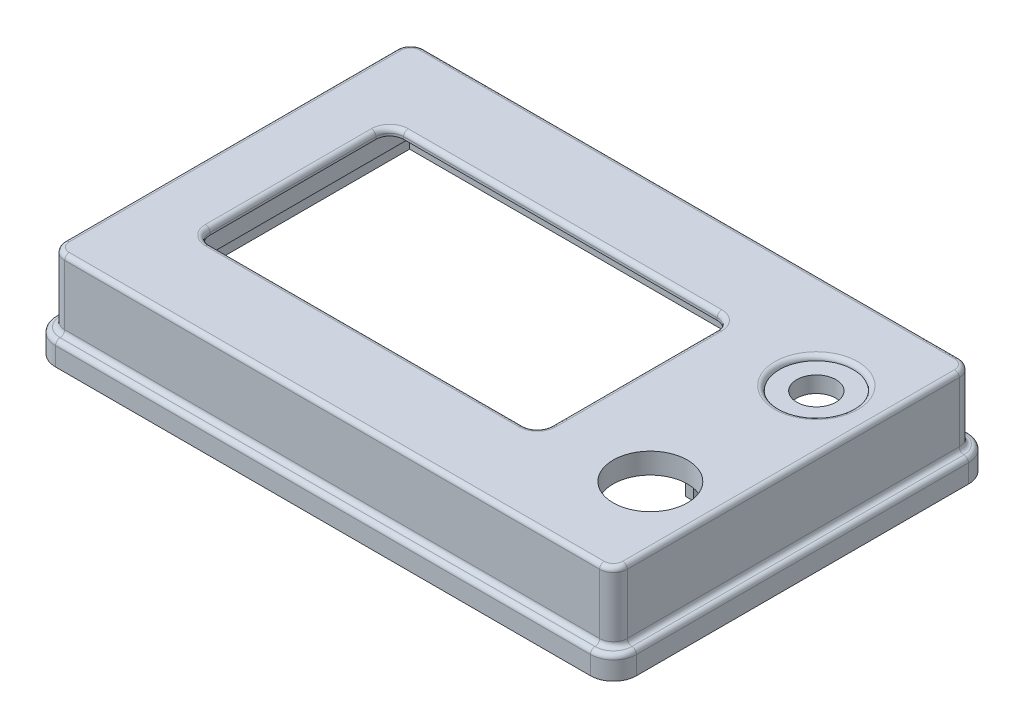
from build123d import *

# Parameters (mm, degrees)
SKETCH1_W                = 122
SKETCH1_H                = 78
SKETCH1_W_2              = 117
SKETCH1_H_2              = 73
BOSS_EXTRUDE1_DEPTH      = 16
SKETCH2_W                = 122
SKETCH2_H                = 78
SKETCH2_W_2              = 74
SKETCH2_H_2              = 42
BOSS_EXTRUDE2_DEPTH      = 2.5
SKETCH3_W                = 80
SKETCH3_H                = 48
CUT_EXTRUDE1_DEPTH       = 1
FILLET1_R                = 3
SKETCH4_R                = 4.25
SKETCH4_R_2              = 8.05
CUT_EXTRUDE2_DEPTH       = 84.00150601
SKETCH5_W                = 20.5
SKETCH5_H                = 73
SKETCH5_R                = 4.25
SKETCH5_R_2              = 8.05
BOSS_EXTRUDE3_DEPTH      = 2
SKETCH6_R                = 8
CUT_EXTRUDE3_DEPTH       = 1
FILLET2_R                = 3
SKETCH7_W                = 1.713480086
SKETCH7_H                = 2
BOSS_EXTRUDE4_DEPTH      = 3
BOSS_EXTRUDE5_DEPTH      = 1.713480086
FILLET3_R                = 1
FILLET4_R                = 1
FILLET5_R                = 1
BOSS_EXTRUDE6_DEPTH      = 4
BOSS_EXTRUDE6_DEPTH_BACK = 1
SKETCH10_W               = 121
SKETCH10_H               = 76.6
CUT_EXTRUDE4_DEPTH       = 86.669422783
FILLET10_R               = 1


with BuildPart() as part:
    # Sketch1 → Boss-Extrude1 (new body)
    with BuildSketch(Plane(origin=(0, -3, 0), x_dir=(1, 0, 0), z_dir=(0, 1, 0))):
        with Locations((10.5, 0)):
            Rectangle(SKETCH1_W, SKETCH1_H)
        with Locations((10.5, 0)):
            Rectangle(SKETCH1_W_2, SKETCH1_H_2, mode=Mode.SUBTRACT)
    extrude(amount=BOSS_EXTRUDE1_DEPTH)

    # Sketch2 → Boss-Extrude2 (add)
    with BuildSketch(Plane(origin=(0, 13, 0), x_dir=(1, 0, 0), z_dir=(0, 1, 0))):
        with Locations((10.5, 0)):
            Rectangle(SKETCH2_W, SKETCH2_H)
        Rectangle(SKETCH2_W_2, SKETCH2_H_2, mode=Mode.SUBTRACT)
    extrude(amount=-BOSS_EXTRUDE2_DEPTH)

    # Sketch3 → Cut-Extrude1 (cut)
    with BuildSketch(Plane.XZ.offset(-10.5)):
        Rectangle(SKETCH3_W, SKETCH3_H)
    extrude(amount=-CUT_EXTRUDE1_DEPTH, mode=Mode.SUBTRACT)

    # Fillet1
    fillet1_edges = [part.edges().sort_by_distance(p)[0] for p in [
        (-50.5, 5, -39),
        (71.5, 5, -39),
        (71.5, 5, 39),
        (-50.5, 5, 39),
    ]]
    fillet(fillet1_edges, radius=FILLET1_R)

    # Sketch4 → Cut-Extrude2 (cut, through all)
    with BuildSketch(Plane(origin=(0, 13, 0), x_dir=(1, 0, 0), z_dir=(0, 1, 0))):
        with Locations(Location((58.5, 18, 0), (0, 0, 270))):
            Circle(SKETCH4_R)
        with Locations(Location((58.5, -18, 0), (0, 0, 270))):
            Circle(SKETCH4_R_2)
    extrude(amount=-CUT_EXTRUDE2_DEPTH, mode=Mode.SUBTRACT)

    # Sketch5 → Boss-Extrude3 (add)
    with BuildSketch(Plane.XZ.offset(-10.5)):
        with Locations((58.75, 0)):
            Rectangle(SKETCH5_W, SKETCH5_H)
        with Locations(Location((58.5, -18, 0), (0, 0, 90))):
            Circle(SKETCH5_R, mode=Mode.SUBTRACT)
        with Locations(Location((58.5, 18, 0), (0, 0, 90))):
            Circle(SKETCH5_R_2, mode=Mode.SUBTRACT)
    extrude(amount=BOSS_EXTRUDE3_DEPTH)

    # Sketch6 → Cut-Extrude3 (cut)
    with BuildSketch(Plane(origin=(0, 13, 0), x_dir=(1, 0, 0), z_dir=(0, 1, 0))):
        with Locations(Location((58.5, 18, 0), (0, 0, 270))):
            Circle(SKETCH6_R)
    extrude(amount=-CUT_EXTRUDE3_DEPTH, mode=Mode.SUBTRACT)

    # Fillet2
    fillet2_edges = [part.edges().sort_by_distance(p)[0] for p in [
        (37, 12.25, 21),
        (-37, 12.25, 21),
        (37, 12.25, -21),
        (-37, 12.25, -21),
    ]]
    fillet(fillet2_edges, radius=FILLET2_R)

    # Sketch7 → Boss-Extrude4 (add)
    with BuildSketch(Plane.XZ.offset(-8.5)):
        with Locations((58.5, 8.5)):
            Rectangle(SKETCH7_W, SKETCH7_H)
    extrude(amount=BOSS_EXTRUDE4_DEPTH)

    # Sketch8 → Boss-Extrude5 (add)
    with BuildSketch(Plane.ZY.offset(-57.643259957)):
        Polygon((7.5, 5.5), (0.486710099, 8.5), (7.5, 8.5), align=None)
    extrude(amount=-BOSS_EXTRUDE5_DEPTH)

    # Fillet3
    fillet3_edges = [part.edges().sort_by_distance(p)[0] for p in [
        (-50.5, 13, 0),
        (10.5, 13, -39),
        (10.5, 13, 39),
        (71.5, 13, 0),
        (70.621320344, 13, 38.121320344),
        (70.621320344, 13, -38.121320344),
        (-49.621320344, 13, 38.121320344),
        (-49.621320344, 13, -38.121320344),
    ]]
    fillet(fillet3_edges, radius=FILLET3_R)

    # Fillet4
    fillet4_edges = [part.edges().sort_by_distance(p)[0] for p in [
        (37, 13, 0),
        (0, 13, 21),
        (-37, 13, 0),
        (0, 13, -21),
        (36.121320344, 13, 20.121320344),
        (-36.121320344, 13, 20.121320344),
        (-36.121320344, 13, -20.121320344),
        (36.121320344, 13, -20.121320344),
    ]]
    fillet(fillet4_edges, radius=FILLET4_R)

    # Fillet5
    fillet5_edges = [part.edges().sort_by_distance(p)[0] for p in [
        (58.5, 13, -26),
    ]]
    fillet(fillet5_edges, radius=FILLET5_R - 0.0001)  # a hair under: the kernel refuses the full size

    # Sketch9 → Boss-Extrude6 (add, two sides: drawn at the far end of the back side and taken through both)
    with BuildSketch(Plane.XZ.offset(3).offset(-BOSS_EXTRUDE6_DEPTH_BACK)):
        with BuildLine():
            Line((-52.5, -36), (-52.5, 36))
            ThreePointArc((-52.5, 36), (-51.035533906, 39.535533906), (-47.5, 41))
            Line((-47.5, 41), (68.5, 41))
            ThreePointArc((68.5, 41), (72.035533906, 39.535533906), (73.5, 36))
            Line((73.5, 36), (73.5, -36))
            ThreePointArc((73.5, -36), (72.035533906, -39.535533906), (68.5, -41))
            Line((68.5, -41), (-47.5, -41))
            ThreePointArc((-47.5, -41), (-51.035533906, -39.535533906), (-52.5, -36))
        make_face()
        with BuildLine():
            Line((-48, 38.3), (69, 38.3))
            ThreePointArc((69, 38.3), (70.414213562, 37.714213562), (71, 36.3))
            Line((71, 36.3), (71, -36.3))
            ThreePointArc((71, -36.3), (70.414213562, -37.714213562), (69, -38.3))
            Line((69, -38.3), (-48, -38.3))
            ThreePointArc((-48, -38.3), (-49.414213562, -37.714213562), (-50, -36.3))
            Line((-50, -36.3), (-50, 36.3))
            ThreePointArc((-50, 36.3), (-49.414213562, 37.714213562), (-48, 38.3))
        make_face(mode=Mode.SUBTRACT)
    extrude(amount=BOSS_EXTRUDE6_DEPTH + BOSS_EXTRUDE6_DEPTH_BACK)

    # Sketch10 → Cut-Extrude4 (cut, through all)
    with BuildSketch(Plane.XZ.offset(3)):
        with Locations((10.5, 0)):
            Rectangle(SKETCH10_W, SKETCH10_H)
    extrude(amount=CUT_EXTRUDE4_DEPTH, mode=Mode.SUBTRACT)

    # Fillet10
    fillet10_edges = [part.edges().sort_by_distance(p)[0] for p in [
        (70.621320344, -2, 38.121320344),
        (-49.621320344, -2, -38.121320344),
        (-49.621320344, -2, 38.121320344),
        (70.621320344, -2, -38.121320344),
        (-51.035533906, -2, 39.535533906),
        (10.5, -2, 41),
        (72.035533906, -2, 39.535533906),
        (73.5, -2, 0),
        (72.035533906, -2, -39.535533906),
        (10.5, -2, -41),
        (-51.035533906, -2, -39.535533906),
        (-52.5, -2, 0),
        (10.5, -2, -39),
        (71.5, -2, 0),
        (10.5, -2, 39),
        (-50.5, -2, 0),
    ]]
    fillet(fillet10_edges, radius=FILLET10_R - 0.0001)  # a hair under: the kernel refuses the full size


solid = part.part
